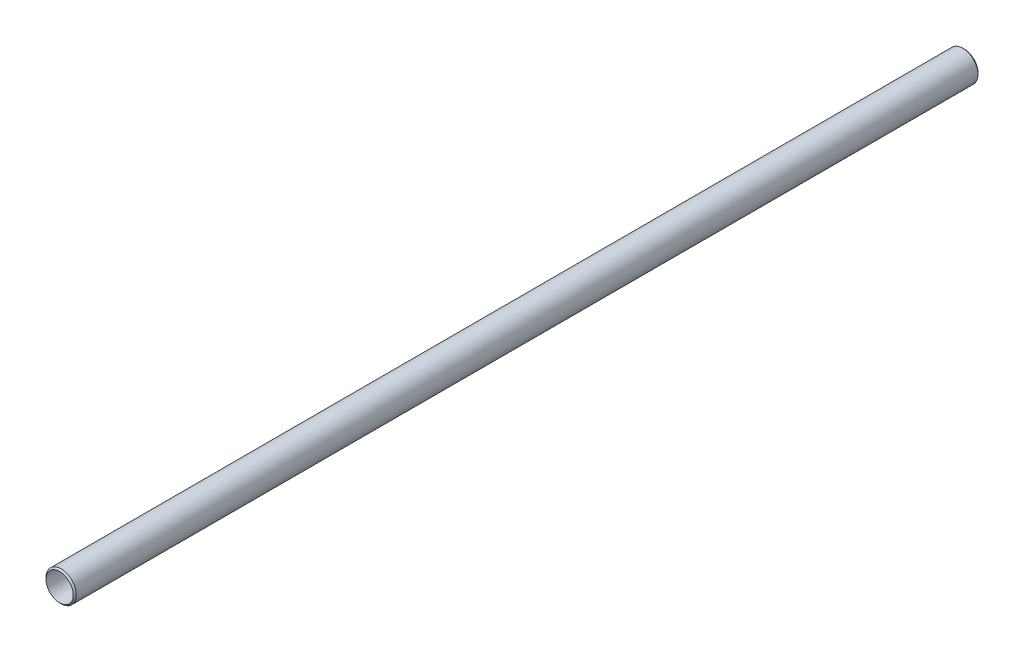
from build123d import *

# Parameters (mm, degrees)
SZKIC1_R                    = 5
SZKIC1_R_2                  = 4.5
DODANIE_WYCI_GNI_CIE1_DEPTH = 300
SFAZOWANIE1_SIZE            = 1


with BuildPart() as part:
    # Szkic1 → Dodanie-wyciągnięcie1 (new body)
    with BuildSketch(Plane.XY):
        Circle(SZKIC1_R)
        Circle(SZKIC1_R_2, mode=Mode.SUBTRACT)
    extrude(amount=DODANIE_WYCI_GNI_CIE1_DEPTH)

    # Sfazowanie1
    # the kernel refuses this chamfer: 1 mm, written as the material it takes off along each edge
    with BuildSketch(Plane(origin=(0, 0, 0), x_dir=(1, 0, 0), z_dir=(0, -1, 0))) as sfazowanie1_piece_1:
        Polygon((5, SFAZOWANIE1_SIZE), (5 - SFAZOWANIE1_SIZE, 0), (5, 0), align=None)
    revolve(axis=Axis((0, 0, 0), (0, 0, 1)), mode=Mode.SUBTRACT)
    with BuildSketch(Plane(origin=(0, 0, 300), x_dir=(1, 0, 0), z_dir=(0, -1, 0))) as sfazowanie1_piece_2:
        Polygon((5, -SFAZOWANIE1_SIZE), (5 - SFAZOWANIE1_SIZE, 0), (5, 0), align=None)
    revolve(axis=Axis((0, 0, 300), (0, 0, 1)), mode=Mode.SUBTRACT)


solid = part.part
